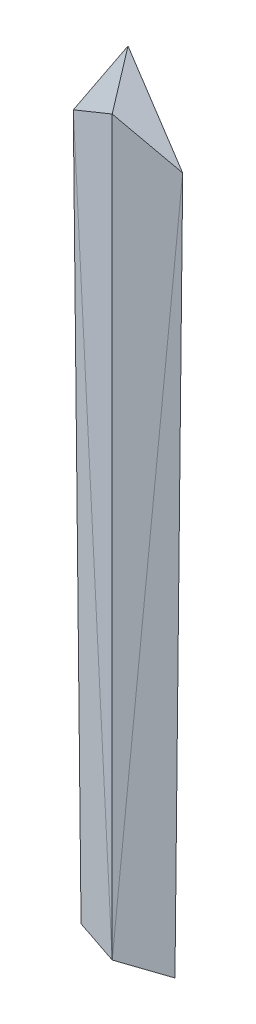
from build123d import *

# Parameters (mm, degrees)
BOSS_EXTRUDE1_DEPTH = 12.7
SKETCH6_W           = 114.815330755
SKETCH6_H           = 104.276185761
CUT_EXTRUDE3_DEPTH  = 12.7
SKETCH7_W           = 122.360161844
SKETCH7_H           = 106.085242249
CUT_EXTRUDE4_DEPTH  = 12.7
CUT_EXTRUDE5_DEPTH  = 877.31520365
SKETCH9_W           = 128.341826347
SKETCH9_H           = 668.528804507
CUT_EXTRUDE6_DEPTH  = 877.394501708
SKETCH10_W          = 113.997044676
SKETCH10_H          = 648.207852324
CUT_EXTRUDE7_DEPTH  = 876.98732182
SKETCH12_W          = 87.20410609
SKETCH12_H          = 734.299119323
CUT_EXTRUDE9_DEPTH  = 868.461646496
SKETCH14_W          = 100.100558247
SKETCH14_H          = 114.490742636
CUT_EXTRUDE10_DEPTH = 12.7
SKETCH15_W          = 127.653675673
SKETCH15_H          = 100.172241776
CUT_EXTRUDE11_DEPTH = 861.862470972
SKETCH16_W          = 131.855297217
SKETCH16_H          = 679.360405527
CUT_EXTRUDE12_DEPTH = 877.165513574
SKETCH17_W          = 119.305490094
SKETCH17_H          = 642.509473181
CUT_EXTRUDE13_DEPTH = 877.394501708
SKETCH18_W          = 98.994393467
SKETCH18_H          = 639.457225447
CUT_EXTRUDE14_DEPTH = 877.31520365
SKETCH19_W          = 99.565921338
SKETCH19_H          = 666.000675121
CUT_EXTRUDE15_DEPTH = 877.394501708
SKETCH20_R          = 4.7625
CUT_EXTRUDE16_DEPTH = 508


# Read off the part's stored shape, not the designer's step: Mirror1
with BuildPart() as part:
    # Sketch1 → Boss-Extrude1 (new, symmetric)
    with BuildSketch(Plane.XY):
        Polygon((52.417084438, 236.384308448), (90.152766869, 236.384308448), (90.152766869, 866.253701631), (46.187524325, 799.857212891), align=None)
        Polygon((90.152766869, 866.253701631), (90.152766869, 236.384308448), (127.8884493, 236.384308448), (134.118009413, 799.857212891), align=None)
    extrude(amount=BOSS_EXTRUDE1_DEPTH, both=True)

    # Sketch6 → Cut-Extrude3 (cut)
    with BuildSketch(Plane(origin=(-80.475493735, 53.287826933, 172.016834397), x_dir=(-0.9129832156192912, -0.12073015458483159, -0.3897253876402993), z_dir=(0.4079971176337633, -0.27016025356830164, -0.8720962042082583))):
        with Locations((-159.579476902, 801.401673743)):
            Rectangle(SKETCH6_W, SKETCH6_H)
    extrude(amount=-CUT_EXTRUDE3_DEPTH, mode=Mode.SUBTRACT)

    # Sketch7 → Cut-Extrude4 (cut)
    with BuildSketch(Plane(origin=(110.489450025, 73.161933124, 236.171839964), x_dir=(0.9129832156192915, -0.12073015458482926, -0.3897253876402993), z_dir=(0.4079971176337626, 0.2701602535682969, 0.8720962042082602))):
        with Locations((1.839292518, 801.972236913)):
            Rectangle(SKETCH7_W, SKETCH7_H)
    extrude(amount=CUT_EXTRUDE4_DEPTH, mode=Mode.SUBTRACT)

    # Sketch8 → Cut-Extrude5 (cut, through all)
    with BuildSketch(Plane(origin=(12.74567879, -0.140911784, 37.871408439), x_dir=(0.947764978993365, 0.0011868122313308312, -0.31896729623965236), z_dir=(0.31896950417509595, -0.0035264157067469155, 0.9477584184793911))):
        Polygon((81.673294324, 236.429925956), (128.061632698, 799.851676208), (231.741614255, 799.851676208), (231.741614255, 224.074314905), align=None)
    extrude(amount=CUT_EXTRUDE5_DEPTH, mode=Mode.SUBTRACT)

    # Sketch9 → Cut-Extrude6 (cut, through all)
    with BuildSketch(Plane(origin=(10.329270127, 0, 35.75817846), x_dir=(-0.9607204173379366, 0, 0.27751807096119224), z_dir=(-0.27751807096119224, 0, -0.9607204173379366))):
        with Locations((-110.06191607, 531.852930857)):
            Rectangle(SKETCH9_W, SKETCH9_H)
    extrude(amount=-CUT_EXTRUDE6_DEPTH, mode=Mode.SUBTRACT)

    # Sketch10 → Cut-Extrude7 (cut, through all)
    with BuildSketch(Plane(origin=(6.175448175, 0.216498836, -18.349193008), x_dir=(-0.9477710226369341, 0.0037629901372113698, -0.3189293472776808), z_dir=(0.31895154592781055, 0.011181801925878497, -0.9477050588954087))):
        with Locations((-63.898815232, 515.571273572)):
            Rectangle(SKETCH10_W, SKETCH10_H)
    extrude(amount=-CUT_EXTRUDE7_DEPTH, mode=Mode.SUBTRACT)

    # Sketch12 → Cut-Extrude9 (cut, through all)
    with BuildSketch(Plane(origin=(90.152766869, 0, 0), x_dir=(0, 0, -1), z_dir=(1, 0, 0))):
        with Locations((-8.892958554, 531.759474075)):
            Rectangle(SKETCH12_W, SKETCH12_H)
    extrude(amount=-CUT_EXTRUDE9_DEPTH, mode=Mode.SUBTRACT)

    # Mirror1: part across plane


with BuildPart() as part_1:
    add(part.part)
    add(part.part.mirror(Plane.ZY.offset(-90.152766869)))

    # Sketch14 → Cut-Extrude10 (cut)
    with BuildSketch(Plane(origin=(110.489450025, 73.161933124, -236.171839964), x_dir=(0.9129832156192876, -0.12073015458483696, 0.3897253876403062), z_dir=(-0.40799711763377144, -0.2701602535683071, 0.8720962042082528))):
        with Locations((-13.369077843, 796.553249818)):
            Rectangle(SKETCH14_W, SKETCH14_H)
    extrude(amount=-CUT_EXTRUDE10_DEPTH, mode=Mode.SUBTRACT)

    # Sketch15 → Cut-Extrude11 (cut, through all)
    with BuildSketch(Plane(origin=(-80.475493735, 53.287826933, -172.016834397), x_dir=(-0.9129832156192877, -0.12073015458483585, 0.3897253876403061), z_dir=(-0.4079971176337711, 0.270160253568305, -0.8720962042082536))):
        with Locations((-157.367388135, 783.503693327)):
            Rectangle(SKETCH15_W, SKETCH15_H)
    extrude(amount=CUT_EXTRUDE11_DEPTH, mode=Mode.SUBTRACT)

    # Sketch16 → Cut-Extrude12 (cut, through all)
    with BuildSketch(Plane(origin=(5.598884712, 0.061899319, 16.636042161), x_dir=(0.9477649789933651, -0.0011868122313305589, -0.3189672962396519), z_dir=(0.31896950417509556, 0.0035264157067461093, 0.9477584184793914))):
        with Locations((56.359358162, 528.47269788)):
            Rectangle(SKETCH16_W, SKETCH16_H)
    extrude(amount=-CUT_EXTRUDE12_DEPTH, mode=Mode.SUBTRACT)

    # Sketch17 → Cut-Extrude13 (cut, through all)
    with BuildSketch(Plane(origin=(3.557191293, 0, 12.314391965), x_dir=(0.9607204173379333, 0, -0.27751807096120285), z_dir=(0.27751807096120285, 0, 0.9607204173379335))):
        with Locations((80.7028718, 538.35243952)):
            Rectangle(SKETCH17_W, SKETCH17_H)
    extrude(amount=-CUT_EXTRUDE13_DEPTH, mode=Mode.SUBTRACT)

    # Sketch18 → Cut-Extrude14 (cut, through all)
    with BuildSketch(Plane(origin=(12.74567879, -0.140911784, -37.871408439), x_dir=(-0.9477649789933651, -0.001186812231330454, -0.31896729623965203), z_dir=(0.31896950417509573, -0.0035264157067457975, -0.9477584184793914))):
        with Locations((-106.935938294, 529.421515118)):
            Rectangle(SKETCH18_W, SKETCH18_H)
    extrude(amount=CUT_EXTRUDE14_DEPTH, mode=Mode.SUBTRACT)

    # Sketch19 → Cut-Extrude15 (cut, through all)
    with BuildSketch(Plane(origin=(10.329270127, 0, -35.75817846), x_dir=(0.9607204173379326, 0, 0.2775180709612057), z_dir=(-0.2775180709612056, 0, 0.9607204173379325))):
        with Locations((102.080018676, 535.484996681)):
            Rectangle(SKETCH19_W, SKETCH19_H)
    extrude(amount=-CUT_EXTRUDE15_DEPTH, mode=Mode.SUBTRACT)

    # Sketch20 → Cut-Extrude16 (cut)
    with BuildSketch(Plane.XZ.offset(-236.384308448)):
        with Locations(Location((90.152766869, 0, 0), (0, 0, 270))):
            Circle(SKETCH20_R)
    extrude(amount=-CUT_EXTRUDE16_DEPTH, mode=Mode.SUBTRACT)


solid = part_1.part
